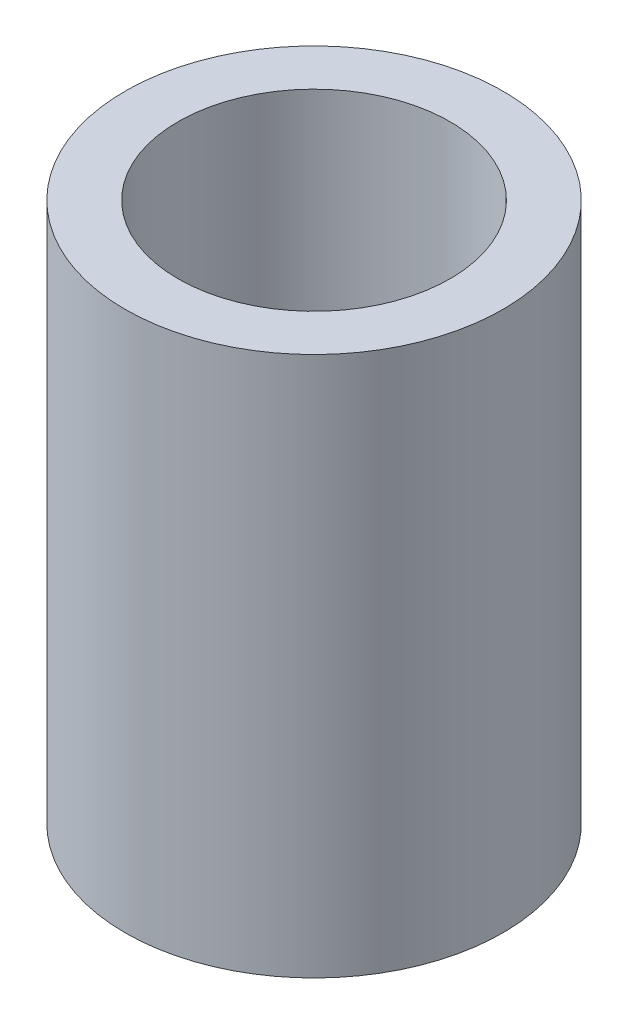
from build123d import *

# Parameters (mm, degrees)
SKETCH1_R           = 4.445
SKETCH1_R_2         = 3.2004
BOSS_EXTRUDE1_DEPTH = 6.35


with BuildPart() as part:
    # Sketch1 → Boss-Extrude1 (new, symmetric)
    with BuildSketch(Plane(origin=(0, 0, 0), x_dir=(1, 0, 0), z_dir=(0, 1, 0))):
        Circle(SKETCH1_R)
        Circle(SKETCH1_R_2, mode=Mode.SUBTRACT)
    extrude(amount=BOSS_EXTRUDE1_DEPTH, both=True)


solid = part.part
